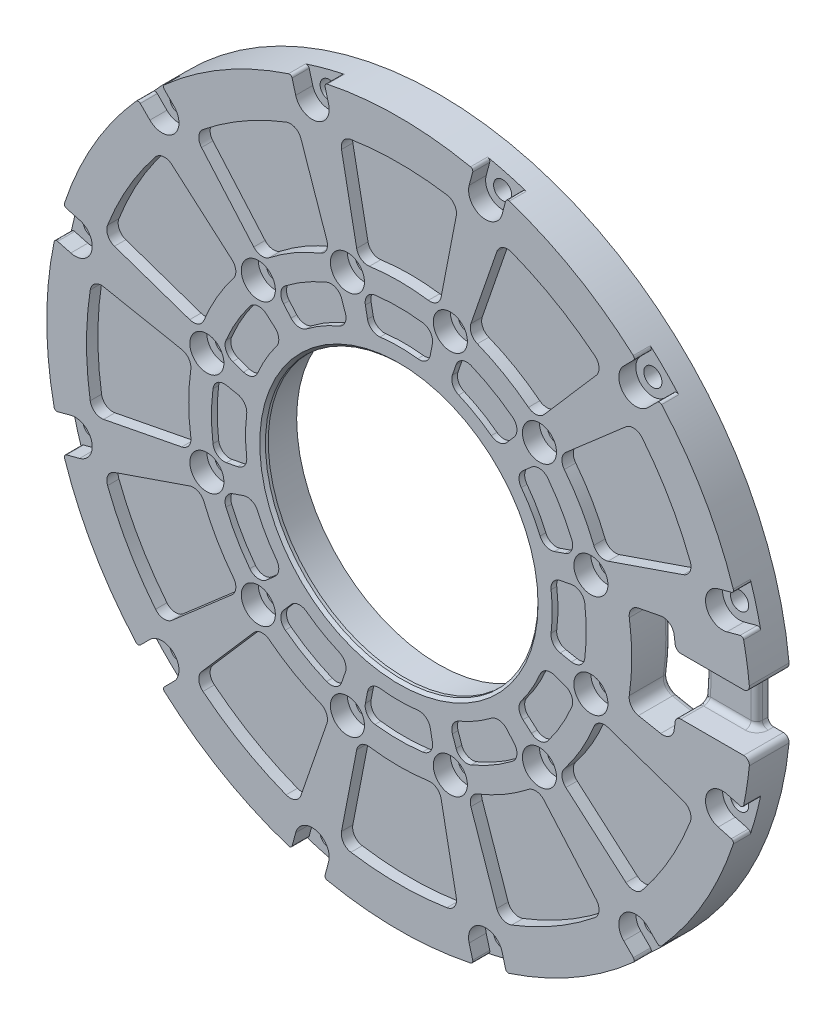
from build123d import *

# Parameters (mm, degrees)
SKETCH1_R           = 39.1
SKETCH1_R_2         = 2.525
SKETCH1_R_3         = 16
BOSS_EXTRUDE1_DEPTH = 7
SKETCH2_R           = 25
CUT_EXTRUDE1_DEPTH  = 6
SKETCH3_R           = 2.55
BOSS_EXTRUDE2_DEPTH = 2
CHAMFER3_SIZE       = 0.5
SKETCH4_R           = 39.1
CUT_EXTRUDE2_DEPTH  = 3
SKETCH5_R           = 24
CUT_EXTRUDE3_DEPTH  = 56.737061279
CHAMFER5_SIZE       = 0.5
SKETCH7_R           = 1.575
CUT_EXTRUDE5_DEPTH  = 56.737061279
BOSS_EXTRUDE3_START = -7
SKETCH8_R           = 62
SKETCH8_R_2         = 39.1
BOSS_EXTRUDE3_DEPTH = 7
SKETCH9_R           = 40
SKETCH9_R_2         = 39.1
CUT_EXTRUDE6_DEPTH  = 3
SKETCH11_R          = 1.6
CUT_EXTRUDE7_DEPTH  = 88.960218281
CUT_EXTRUDE9_DEPTH  = 1
CUT_EXTRUDE10_DEPTH = 2
CUT_EXTRUDE11_DEPTH = 88.960218281
SKETCH15_W          = 13
SKETCH15_H          = 5
CUT_EXTRUDE14_DEPTH = 5
SKETCH16_W          = 4
SKETCH16_H          = 10
CUT_EXTRUDE15_DEPTH = 88.960218281
FILLET3_R           = 1
CUT_EXTRUDE16_DEPTH = 3
SKETCH18_R          = 3
CUT_EXTRUDE17_DEPTH = 3
FILLET5_R           = 0.5
FILLET6_R           = 1


with BuildPart() as part:
    # Sketch1 → Boss-Extrude1 (new body)
    with BuildSketch(Plane.XY.offset(15)):
        Circle(SKETCH1_R)
        with Locations((32.5, 0)):
            Circle(SKETCH1_R_2, mode=Mode.SUBTRACT)
        with Locations((28.145825623, -16.25)):
            Circle(SKETCH1_R_2, mode=Mode.SUBTRACT)
        with Locations((16.25, -28.145825623)):
            Circle(SKETCH1_R_2, mode=Mode.SUBTRACT)
        with Locations((0, -32.5)):
            Circle(SKETCH1_R_2, mode=Mode.SUBTRACT)
        with Locations((-16.25, -28.145825623)):
            Circle(SKETCH1_R_2, mode=Mode.SUBTRACT)
        with Locations((-28.145825623, -16.25)):
            Circle(SKETCH1_R_2, mode=Mode.SUBTRACT)
        with Locations((-32.5, 0)):
            Circle(SKETCH1_R_2, mode=Mode.SUBTRACT)
        with Locations((-28.145825623, 16.25)):
            Circle(SKETCH1_R_2, mode=Mode.SUBTRACT)
        with Locations((-16.25, 28.145825623)):
            Circle(SKETCH1_R_2, mode=Mode.SUBTRACT)
        with Locations((0, 32.5)):
            Circle(SKETCH1_R_2, mode=Mode.SUBTRACT)
        with Locations((16.25, 28.145825623)):
            Circle(SKETCH1_R_2, mode=Mode.SUBTRACT)
        Circle(SKETCH1_R_3, mode=Mode.SUBTRACT)
        with Locations((28.145825623, 16.25)):
            Circle(SKETCH1_R_2, mode=Mode.SUBTRACT)
    extrude(amount=BOSS_EXTRUDE1_DEPTH)

    # Sketch2 → Cut-Extrude1 (cut)
    with BuildSketch(Plane(origin=(0, 0, 15), x_dir=(-1, 0, 0), z_dir=(0, 0, -1))):
        Circle(SKETCH2_R)
    extrude(amount=-CUT_EXTRUDE1_DEPTH, mode=Mode.SUBTRACT)

    # Sketch3 → Boss-Extrude2 (add)
    with BuildSketch(Plane.XY.offset(22)):
        with Locations((-16.25, 28.145825623)):
            Circle(SKETCH3_R)
        with Locations((0, 32.5)):
            Circle(SKETCH3_R)
        with Locations((16.25, 28.145825623)):
            Circle(SKETCH3_R)
        with Locations((28.145825623, 16.25)):
            Circle(SKETCH3_R)
        with Locations((32.5, 0)):
            Circle(SKETCH3_R)
        with Locations((28.145825623, -16.25)):
            Circle(SKETCH3_R)
        with Locations((16.25, -28.145825623)):
            Circle(SKETCH3_R)
        with Locations((0, -32.5)):
            Circle(SKETCH3_R)
        with Locations((-16.25, -28.145825623)):
            Circle(SKETCH3_R)
        with Locations((-28.145825623, -16.25)):
            Circle(SKETCH3_R)
        with Locations((-32.5, 0)):
            Circle(SKETCH3_R)
        with Locations((-28.145825623, 16.25)):
            Circle(SKETCH3_R)
    extrude(amount=-BOSS_EXTRUDE2_DEPTH)

    # Chamfer3
    chamfer3_edges = [part.edges().sort_by_distance(p)[0] for p in [
        (13.725, -28.145825623, 15),
        (-2.525, -32.5, 15),
        (-18.775, -28.145825623, 15),
        (-30.670825623, -16.25, 15),
        (-35.025, 0, 15),
        (-30.670825623, 16.25, 15),
        (-18.775, 28.145825623, 15),
        (-2.525, 32.5, 15),
        (13.725, 28.145825623, 15),
        (25.620825623, 16.25, 15),
        (29.975, 0, 15),
        (25.620825623, -16.25, 15),
    ]]
    chamfer(chamfer3_edges, length=CHAMFER3_SIZE)

    # Sketch4 → Cut-Extrude2 (cut)
    with BuildSketch(Plane(origin=(0, 0, 15), x_dir=(-1, 0, 0), z_dir=(0, 0, -1))):
        Circle(SKETCH4_R)
        with BuildLine():
            ThreePointArc((6.048999917, 32.39), (0, 38.55), (-6.048999917, 32.39))
            ThreePointArc((-6.048999917, 32.39), (-8.528087536, 31.827255976), (-10.956412404, 31.075062787))
            ThreePointArc((-10.956412404, 31.075062787), (-19.275, 33.385279316), (-21.433587596, 25.02606287))
            ThreePointArc((-21.433587596, 25.02606287), (-23.29916844, 23.29916844), (-25.02606287, 21.433587596))
            ThreePointArc((-25.02606287, 21.433587596), (-33.385279316, 19.275), (-31.075062787, 10.956412404))
            ThreePointArc((-31.075062787, 10.956412404), (-31.827255976, 8.528087536), (-32.39, 6.048999917))
            ThreePointArc((-32.39, 6.048999917), (-38.55, 0), (-32.39, -6.048999917))
            ThreePointArc((-32.39, -6.048999917), (-31.827255976, -8.528087536), (-31.075062787, -10.956412404))
            ThreePointArc((-31.075062787, -10.956412404), (-33.385279316, -19.275), (-25.02606287, -21.433587596))
            ThreePointArc((-25.02606287, -21.433587596), (-23.29916844, -23.29916844), (-21.433587596, -25.02606287))
            ThreePointArc((-21.433587596, -25.02606287), (-19.275, -33.385279316), (-10.956412404, -31.075062787))
            ThreePointArc((-10.956412404, -31.075062787), (-8.528087536, -31.827255976), (-6.048999917, -32.39))
            ThreePointArc((-6.048999917, -32.39), (0, -38.55), (6.048999917, -32.39))
            ThreePointArc((6.048999917, -32.39), (8.528087536, -31.827255976), (10.956412404, -31.075062787))
            ThreePointArc((10.956412404, -31.075062787), (19.275, -33.385279316), (21.433587596, -25.02606287))
            ThreePointArc((21.433587596, -25.02606287), (23.29916844, -23.29916844), (25.02606287, -21.433587596))
            ThreePointArc((25.02606287, -21.433587596), (33.385279316, -19.275), (31.075062787, -10.956412404))
            ThreePointArc((31.075062787, -10.956412404), (31.827255976, -8.528087536), (32.39, -6.048999917))
            ThreePointArc((32.39, -6.048999917), (38.55, 0), (32.39, 6.048999917))
            ThreePointArc((32.39, 6.048999917), (31.827255976, 8.528087536), (31.075062787, 10.956412404))
            ThreePointArc((31.075062787, 10.956412404), (33.385279316, 19.275), (25.02606287, 21.433587596))
            ThreePointArc((25.02606287, 21.433587596), (23.29916844, 23.29916844), (21.433587596, 25.02606287))
            ThreePointArc((21.433587596, 25.02606287), (19.275, 33.385279316), (10.956412404, 31.075062787))
            ThreePointArc((10.956412404, 31.075062787), (8.528087536, 31.827255976), (6.048999917, 32.39))
        make_face(mode=Mode.SUBTRACT)
    extrude(amount=-CUT_EXTRUDE2_DEPTH, mode=Mode.SUBTRACT)

    # Sketch5 → Cut-Extrude3 (cut, through all)
    with BuildSketch(Plane.XY.offset(22)):
        Circle(SKETCH5_R)
    extrude(amount=-CUT_EXTRUDE3_DEPTH, mode=Mode.SUBTRACT)

    # Chamfer5
    chamfer5_edges = [part.edges().sort_by_distance(p)[0] for p in [
        (-24, 0, 22),
    ]]
    chamfer(chamfer5_edges, length=CHAMFER5_SIZE)

    # Sketch7 → Cut-Extrude5 (cut, through all)
    with BuildSketch(Plane.XY.offset(22)):
        with Locations((-33.80740392, -9.058666579)):
            Circle(SKETCH7_R)
        with Locations((-33.80740392, 9.058666579)):
            Circle(SKETCH7_R)
        with Locations((-24.748737342, 24.748737342)):
            Circle(SKETCH7_R)
        with Locations((-9.058666579, 33.80740392)):
            Circle(SKETCH7_R)
        with Locations((9.058666579, 33.80740392)):
            Circle(SKETCH7_R)
        with Locations((24.748737342, 24.748737342)):
            Circle(SKETCH7_R)
        with Locations((33.80740392, 9.058666579)):
            Circle(SKETCH7_R)
        with Locations((33.80740392, -9.058666579)):
            Circle(SKETCH7_R)
        with Locations((24.748737342, -24.748737342)):
            Circle(SKETCH7_R)
        with Locations((9.058666579, -33.80740392)):
            Circle(SKETCH7_R)
        with Locations((-9.058666579, -33.80740392)):
            Circle(SKETCH7_R)
        with Locations((-24.748737342, -24.748737342)):
            Circle(SKETCH7_R)
    extrude(amount=-CUT_EXTRUDE5_DEPTH, mode=Mode.SUBTRACT)

    # Sketch8 → Boss-Extrude3 (add)
    with BuildSketch(Plane.XY.offset(22).offset(BOSS_EXTRUDE3_START)):
        Circle(SKETCH8_R)
        Circle(SKETCH8_R_2, mode=Mode.SUBTRACT)
    extrude(amount=BOSS_EXTRUDE3_DEPTH)

    # Sketch9 → Cut-Extrude6 (cut)
    with BuildSketch(Plane(origin=(0, 0, 15), x_dir=(-1, 0, 0), z_dir=(0, 0, -1))):
        Circle(SKETCH9_R)
        Circle(SKETCH9_R_2, mode=Mode.SUBTRACT)
    extrude(amount=-CUT_EXTRUDE6_DEPTH, mode=Mode.SUBTRACT)

    # Sketch11 → Cut-Extrude7 (cut, through all)
    with BuildSketch(Plane.XY.offset(22)):
        with Locations((-56.989623751, -15.270323661)):
            Circle(SKETCH11_R)
        with Locations((-56.989623751, 15.270323661)):
            Circle(SKETCH11_R)
        with Locations((-41.71930009, 41.71930009)):
            Circle(SKETCH11_R)
        with Locations((-15.270323661, 56.989623751)):
            Circle(SKETCH11_R)
        with Locations((15.270323661, 56.989623751)):
            Circle(SKETCH11_R)
        with Locations((41.71930009, 41.71930009)):
            Circle(SKETCH11_R)
        with Locations((56.989623751, 15.270323661)):
            Circle(SKETCH11_R)
        with Locations((56.989623751, -15.270323661)):
            Circle(SKETCH11_R)
        with Locations((41.71930009, -41.71930009)):
            Circle(SKETCH11_R)
        with Locations((15.270323661, -56.989623751)):
            Circle(SKETCH11_R)
        with Locations((-15.270323661, -56.989623751)):
            Circle(SKETCH11_R)
        with Locations((-41.71930009, -41.71930009)):
            Circle(SKETCH11_R)
    extrude(amount=-CUT_EXTRUDE7_DEPTH, mode=Mode.SUBTRACT)

    # Sketch12 → Cut-Extrude9 (cut)
    with BuildSketch(Plane.XY.offset(22)):
        with BuildLine():
            ThreePointArc((30.367045862, 5.902755762), (31.919981189, 5.560616967), (32.732448618, 4.193662776))
            ThreePointArc((32.732448618, 4.193662776), (33, 0), (32.732448618, -4.193662776))
            ThreePointArc((32.732448618, -4.193662776), (31.919981189, -5.560616967), (30.367045862, -5.902755762))
            Line((30.367045862, -5.902755762), (28.399409204, -5.52028594))
            ThreePointArc((28.399409204, -5.52028594), (27.162527298, -4.731960544), (26.796128768, -3.311719051))
            ThreePointArc((26.796128768, -3.311719051), (27, 0), (26.796128768, 3.311719051))
            ThreePointArc((26.796128768, 3.311719051), (27.162527298, 4.731960544), (28.399409204, 5.52028594))
            Line((28.399409204, 5.52028594), (30.367045862, 5.902755762))
        make_face()
        with BuildLine():
            ThreePointArc((29.250011036, -10.071586489), (30.423823082, -11.14435504), (30.443963419, -12.73440581))
            ThreePointArc((30.443963419, -12.73440581), (28.578838325, -16.5), (26.250300643, -19.998042808))
            ThreePointArc((26.250300643, -19.998042808), (24.863206115, -20.775626149), (23.347255274, -20.295459374))
            Line((23.347255274, -20.295459374), (21.834466853, -18.980412463))
            ThreePointArc((21.834466853, -18.980412463), (21.157458399, -17.67926169), (21.55026871, -16.266097212))
            ThreePointArc((21.55026871, -16.266097212), (23.382685902, -13.5), (24.861987761, -10.530031555))
            ThreePointArc((24.861987761, -10.530031555), (25.889418943, -9.483265609), (27.354752793, -9.418996741))
            Line((27.354752793, -9.418996741), (29.250011036, -10.071586489))
        make_face()
        with BuildLine():
            ThreePointArc((20.295459374, -23.347255274), (20.775626149, -24.863206115), (19.998042808, -26.250300643))
            ThreePointArc((19.998042808, -26.250300643), (16.5, -28.578838325), (12.73440581, -30.443963419))
            ThreePointArc((12.73440581, -30.443963419), (11.14435504, -30.423823082), (10.071586489, -29.250011036))
            Line((10.071586489, -29.250011036), (9.418996741, -27.354752793))
            ThreePointArc((9.418996741, -27.354752793), (9.483265609, -25.889418943), (10.530031555, -24.861987761))
            ThreePointArc((10.530031555, -24.861987761), (13.5, -23.382685902), (16.266097212, -21.55026871))
            ThreePointArc((16.266097212, -21.55026871), (17.67926169, -21.157458399), (18.980412463, -21.834466853))
            Line((18.980412463, -21.834466853), (20.295459374, -23.347255274))
        make_face()
        with BuildLine():
            ThreePointArc((5.902755762, -30.367045862), (5.560616967, -31.919981189), (4.193662776, -32.732448618))
            ThreePointArc((4.193662776, -32.732448618), (0, -33), (-4.193662776, -32.732448618))
            ThreePointArc((-4.193662776, -32.732448618), (-5.560616967, -31.919981189), (-5.902755762, -30.367045862))
            Line((-5.902755762, -30.367045862), (-5.52028594, -28.399409204))
            ThreePointArc((-5.52028594, -28.399409204), (-4.731960544, -27.162527298), (-3.311719051, -26.796128768))
            ThreePointArc((-3.311719051, -26.796128768), (0, -27), (3.311719051, -26.796128768))
            ThreePointArc((3.311719051, -26.796128768), (4.731960544, -27.162527298), (5.52028594, -28.399409204))
            Line((5.52028594, -28.399409204), (5.902755762, -30.367045862))
        make_face()
        with BuildLine():
            Line((-30.367045862, 5.902755762), (-28.399409204, 5.52028594))
            ThreePointArc((-28.399409204, 5.52028594), (-27.162527298, 4.731960544), (-26.796128768, 3.311719051))
            ThreePointArc((-26.796128768, 3.311719051), (-27, 0), (-26.796128768, -3.311719051))
            ThreePointArc((-26.796128768, -3.311719051), (-27.162527298, -4.731960544), (-28.399409204, -5.52028594))
            Line((-28.399409204, -5.52028594), (-30.367045862, -5.902755762))
            ThreePointArc((-30.367045862, -5.902755762), (-31.919981189, -5.560616967), (-32.732448618, -4.193662776))
            ThreePointArc((-32.732448618, -4.193662776), (-33, 0), (-32.732448618, 4.193662776))
            ThreePointArc((-32.732448618, 4.193662776), (-31.919981189, 5.560616967), (-30.367045862, 5.902755762))
        make_face()
        with BuildLine():
            ThreePointArc((-10.071586489, -29.250011036), (-11.14435504, -30.423823082), (-12.73440581, -30.443963419))
            ThreePointArc((-12.73440581, -30.443963419), (-16.5, -28.578838325), (-19.998042808, -26.250300643))
            ThreePointArc((-19.998042808, -26.250300643), (-20.775626149, -24.863206115), (-20.295459374, -23.347255274))
            Line((-20.295459374, -23.347255274), (-18.980412463, -21.834466853))
            ThreePointArc((-18.980412463, -21.834466853), (-17.67926169, -21.157458399), (-16.266097212, -21.55026871))
            ThreePointArc((-16.266097212, -21.55026871), (-13.5, -23.382685902), (-10.530031555, -24.861987761))
            ThreePointArc((-10.530031555, -24.861987761), (-9.483265609, -25.889418943), (-9.418996741, -27.354752793))
            Line((-9.418996741, -27.354752793), (-10.071586489, -29.250011036))
        make_face()
        with BuildLine():
            ThreePointArc((-29.250011036, 10.071586489), (-30.423823082, 11.14435504), (-30.443963419, 12.73440581))
            ThreePointArc((-30.443963419, 12.73440581), (-28.578838325, 16.5), (-26.250300643, 19.998042808))
            ThreePointArc((-26.250300643, 19.998042808), (-24.863206115, 20.775626149), (-23.347255274, 20.295459374))
            Line((-23.347255274, 20.295459374), (-21.834466853, 18.980412463))
            ThreePointArc((-21.834466853, 18.980412463), (-21.157458399, 17.67926169), (-21.55026871, 16.266097212))
            ThreePointArc((-21.55026871, 16.266097212), (-23.382685902, 13.5), (-24.861987761, 10.530031555))
            ThreePointArc((-24.861987761, 10.530031555), (-25.889418943, 9.483265609), (-27.354752793, 9.418996741))
            Line((-27.354752793, 9.418996741), (-29.250011036, 10.071586489))
        make_face()
        with BuildLine():
            ThreePointArc((-20.295459374, 23.347255274), (-20.775626149, 24.863206115), (-19.998042808, 26.250300643))
            ThreePointArc((-19.998042808, 26.250300643), (-16.5, 28.578838325), (-12.73440581, 30.443963419))
            ThreePointArc((-12.73440581, 30.443963419), (-11.14435504, 30.423823082), (-10.071586489, 29.250011036))
            Line((-10.071586489, 29.250011036), (-9.418996741, 27.354752793))
            ThreePointArc((-9.418996741, 27.354752793), (-9.483265609, 25.889418943), (-10.530031555, 24.861987761))
            ThreePointArc((-10.530031555, 24.861987761), (-13.5, 23.382685902), (-16.266097212, 21.55026871))
            ThreePointArc((-16.266097212, 21.55026871), (-17.67926169, 21.157458399), (-18.980412463, 21.834466853))
            Line((-18.980412463, 21.834466853), (-20.295459374, 23.347255274))
        make_face()
        with BuildLine():
            ThreePointArc((-5.902755762, 30.367045862), (-5.560616967, 31.919981189), (-4.193662776, 32.732448618))
            ThreePointArc((-4.193662776, 32.732448618), (0, 33), (4.193662776, 32.732448618))
            ThreePointArc((4.193662776, 32.732448618), (5.560616967, 31.919981189), (5.902755762, 30.367045862))
            Line((5.902755762, 30.367045862), (5.52028594, 28.399409204))
            ThreePointArc((5.52028594, 28.399409204), (4.731960544, 27.162527298), (3.311719051, 26.796128768))
            ThreePointArc((3.311719051, 26.796128768), (0, 27), (-3.311719051, 26.796128768))
            ThreePointArc((-3.311719051, 26.796128768), (-4.731960544, 27.162527298), (-5.52028594, 28.399409204))
            Line((-5.52028594, 28.399409204), (-5.902755762, 30.367045862))
        make_face()
        with BuildLine():
            ThreePointArc((10.071586489, 29.250011036), (11.14435504, 30.423823082), (12.73440581, 30.443963419))
            ThreePointArc((12.73440581, 30.443963419), (16.5, 28.578838325), (19.998042808, 26.250300643))
            ThreePointArc((19.998042808, 26.250300643), (20.775626149, 24.863206115), (20.295459374, 23.347255274))
            Line((20.295459374, 23.347255274), (18.980412463, 21.834466853))
            ThreePointArc((18.980412463, 21.834466853), (17.67926169, 21.157458399), (16.266097212, 21.55026871))
            ThreePointArc((16.266097212, 21.55026871), (13.5, 23.382685902), (10.530031555, 24.861987761))
            ThreePointArc((10.530031555, 24.861987761), (9.483265609, 25.889418943), (9.418996741, 27.354752793))
            Line((9.418996741, 27.354752793), (10.071586489, 29.250011036))
        make_face()
        with BuildLine():
            ThreePointArc((23.347255274, 20.295459374), (24.863206115, 20.775626149), (26.250300643, 19.998042808))
            ThreePointArc((26.250300643, 19.998042808), (28.578838325, 16.5), (30.443963419, 12.73440581))
            ThreePointArc((30.443963419, 12.73440581), (30.423823082, 11.14435504), (29.250011036, 10.071586489))
            Line((29.250011036, 10.071586489), (27.354752793, 9.418996741))
            ThreePointArc((27.354752793, 9.418996741), (25.889418943, 9.483265609), (24.861987761, 10.530031555))
            ThreePointArc((24.861987761, 10.530031555), (23.382685902, 13.5), (21.55026871, 16.266097212))
            ThreePointArc((21.55026871, 16.266097212), (21.157458399, 17.67926169), (21.834466853, 18.980412463))
            Line((21.834466853, 18.980412463), (23.347255274, 20.295459374))
        make_face()
        with BuildLine():
            ThreePointArc((-23.347255274, -20.295459374), (-24.863206115, -20.775626149), (-26.250300643, -19.998042808))
            ThreePointArc((-26.250300643, -19.998042808), (-28.578838325, -16.5), (-30.443963419, -12.73440581))
            ThreePointArc((-30.443963419, -12.73440581), (-30.423823082, -11.14435504), (-29.250011036, -10.071586489))
            Line((-29.250011036, -10.071586489), (-27.354752793, -9.418996741))
            ThreePointArc((-27.354752793, -9.418996741), (-25.889418943, -9.483265609), (-24.861987761, -10.530031555))
            ThreePointArc((-24.861987761, -10.530031555), (-23.382685902, -13.5), (-21.55026871, -16.266097212))
            ThreePointArc((-21.55026871, -16.266097212), (-21.157458399, -17.67926169), (-21.834466853, -18.980412463))
            Line((-21.834466853, -18.980412463), (-23.347255274, -20.295459374))
        make_face()
    extrude(amount=-CUT_EXTRUDE9_DEPTH, mode=Mode.SUBTRACT)

    # Sketch12<3> → Cut-Extrude10 (cut)
    with BuildSketch(Plane.XY.offset(22)):
        with BuildLine():
            ThreePointArc((29.132341965, -22.810231293), (32.04293994, -18.5), (34.320410749, -13.824232567))
            ThreePointArc((34.320410749, -13.824232567), (35.345221414, -12.752003728), (36.826704395, -12.68045123))
            Line((36.826704395, -12.68045123), (50.076791849, -17.242822219))
            ThreePointArc((50.076791849, -17.242822219), (51.239468775, -18.291196003), (51.290774618, -19.855891799))
            ThreePointArc((51.290774618, -19.855891799), (47.631397208, -27.5), (42.841094021, -34.491167899))
            ThreePointArc((42.841094021, -34.491167899), (41.460374791, -35.229083634), (39.971117999, -34.746362772))
            Line((39.971117999, -34.746362772), (29.394945094, -25.552635929))
            ThreePointArc((29.394945094, -25.552635929), (28.716169884, -24.233857783), (29.132341965, -22.810231293))
        make_face()
        with BuildLine():
            ThreePointArc((13.824232567, -34.320410749), (18.5, -32.04293994), (22.810231293, -29.132341965))
            ThreePointArc((22.810231293, -29.132341965), (24.233857783, -28.716169884), (25.552635929, -29.394945094))
            Line((25.552635929, -29.394945094), (34.746362772, -39.971117999))
            ThreePointArc((34.746362772, -39.971117999), (35.229083634, -41.460374791), (34.491167899, -42.841094021))
            ThreePointArc((34.491167899, -42.841094021), (27.5, -47.631397208), (19.855891799, -51.290774618))
            ThreePointArc((19.855891799, -51.290774618), (18.291196003, -51.239468775), (17.242822219, -50.076791849))
            Line((17.242822219, -50.076791849), (12.68045123, -36.826704395))
            ThreePointArc((12.68045123, -36.826704395), (12.752003728, -35.345221414), (13.824232567, -34.320410749))
        make_face()
        with BuildLine():
            ThreePointArc((-5.188068784, -36.63446386), (0, -37), (5.188068784, -36.63446386))
            ThreePointArc((5.188068784, -36.63446386), (6.62905153, -36.985861511), (7.431759301, -38.233087159))
            Line((7.431759301, -38.233087159), (10.10567385, -51.989184991))
            ThreePointArc((10.10567385, -51.989184991), (9.779093984, -53.520279637), (8.449680596, -54.347059698))
            ThreePointArc((8.449680596, -54.347059698), (0, -55), (-8.449680596, -54.347059698))
            ThreePointArc((-8.449680596, -54.347059698), (-9.779093984, -53.520279637), (-10.10567385, -51.989184991))
            Line((-10.10567385, -51.989184991), (-7.431759301, -38.233087159))
            ThreePointArc((-7.431759301, -38.233087159), (-6.62905153, -36.985861511), (-5.188068784, -36.63446386))
        make_face()
        with BuildLine():
            ThreePointArc((-22.810231293, -29.132341965), (-18.5, -32.04293994), (-13.824232567, -34.320410749))
            ThreePointArc((-13.824232567, -34.320410749), (-12.752003728, -35.345221414), (-12.68045123, -36.826704395))
            Line((-12.68045123, -36.826704395), (-17.242822219, -50.076791849))
            ThreePointArc((-17.242822219, -50.076791849), (-18.291196003, -51.239468775), (-19.855891799, -51.290774618))
            ThreePointArc((-19.855891799, -51.290774618), (-27.5, -47.631397208), (-34.491167899, -42.841094021))
            ThreePointArc((-34.491167899, -42.841094021), (-35.229083634, -41.460374791), (-34.746362772, -39.971117999))
            Line((-34.746362772, -39.971117999), (-25.552635929, -29.394945094))
            ThreePointArc((-25.552635929, -29.394945094), (-24.233857783, -28.716169884), (-22.810231293, -29.132341965))
        make_face()
        with BuildLine():
            Line((-51.989184991, 10.10567385), (-38.233087159, 7.431759301))
            ThreePointArc((-38.233087159, 7.431759301), (-36.985861511, 6.62905153), (-36.63446386, 5.188068784))
            ThreePointArc((-36.63446386, 5.188068784), (-37, 0), (-36.63446386, -5.188068784))
            ThreePointArc((-36.63446386, -5.188068784), (-36.985861511, -6.62905153), (-38.233087159, -7.431759301))
            Line((-38.233087159, -7.431759301), (-51.989184991, -10.10567385))
            ThreePointArc((-51.989184991, -10.10567385), (-53.520279637, -9.779093984), (-54.347059698, -8.449680596))
            ThreePointArc((-54.347059698, -8.449680596), (-55, 0), (-54.347059698, 8.449680596))
            ThreePointArc((-54.347059698, 8.449680596), (-53.520279637, 9.779093984), (-51.989184991, 10.10567385))
        make_face()
        with BuildLine():
            ThreePointArc((-29.132341965, 22.810231293), (-32.04293994, 18.5), (-34.320410749, 13.824232567))
            ThreePointArc((-34.320410749, 13.824232567), (-35.345221414, 12.752003728), (-36.826704395, 12.68045123))
            Line((-36.826704395, 12.68045123), (-50.076791849, 17.242822219))
            ThreePointArc((-50.076791849, 17.242822219), (-51.239468775, 18.291196003), (-51.290774618, 19.855891799))
            ThreePointArc((-51.290774618, 19.855891799), (-47.631397208, 27.5), (-42.841094021, 34.491167899))
            ThreePointArc((-42.841094021, 34.491167899), (-41.460374791, 35.229083634), (-39.971117999, 34.746362772))
            Line((-39.971117999, 34.746362772), (-29.394945094, 25.552635929))
            ThreePointArc((-29.394945094, 25.552635929), (-28.716169884, 24.233857783), (-29.132341965, 22.810231293))
        make_face()
        with BuildLine():
            ThreePointArc((-13.824232567, 34.320410749), (-18.5, 32.04293994), (-22.810231293, 29.132341965))
            ThreePointArc((-22.810231293, 29.132341965), (-24.233857783, 28.716169884), (-25.552635929, 29.394945094))
            Line((-25.552635929, 29.394945094), (-34.746362772, 39.971117999))
            ThreePointArc((-34.746362772, 39.971117999), (-35.229083634, 41.460374791), (-34.491167899, 42.841094021))
            ThreePointArc((-34.491167899, 42.841094021), (-27.5, 47.631397208), (-19.855891799, 51.290774618))
            ThreePointArc((-19.855891799, 51.290774618), (-18.291196003, 51.239468775), (-17.242822219, 50.076791849))
            Line((-17.242822219, 50.076791849), (-12.68045123, 36.826704395))
            ThreePointArc((-12.68045123, 36.826704395), (-12.752003728, 35.345221414), (-13.824232567, 34.320410749))
        make_face()
        with BuildLine():
            ThreePointArc((5.188068784, 36.63446386), (0, 37), (-5.188068784, 36.63446386))
            ThreePointArc((-5.188068784, 36.63446386), (-6.62905153, 36.985861511), (-7.431759301, 38.233087159))
            Line((-7.431759301, 38.233087159), (-10.10567385, 51.989184991))
            ThreePointArc((-10.10567385, 51.989184991), (-9.779093984, 53.520279637), (-8.449680596, 54.347059698))
            ThreePointArc((-8.449680596, 54.347059698), (0, 55), (8.449680596, 54.347059698))
            ThreePointArc((8.449680596, 54.347059698), (9.779093984, 53.520279637), (10.10567385, 51.989184991))
            Line((10.10567385, 51.989184991), (7.431759301, 38.233087159))
            ThreePointArc((7.431759301, 38.233087159), (6.62905153, 36.985861511), (5.188068784, 36.63446386))
        make_face()
        with BuildLine():
            ThreePointArc((22.810231293, 29.132341965), (18.5, 32.04293994), (13.824232567, 34.320410749))
            ThreePointArc((13.824232567, 34.320410749), (12.752003728, 35.345221414), (12.68045123, 36.826704395))
            Line((12.68045123, 36.826704395), (17.242822219, 50.076791849))
            ThreePointArc((17.242822219, 50.076791849), (18.291196003, 51.239468775), (19.855891799, 51.290774618))
            ThreePointArc((19.855891799, 51.290774618), (27.5, 47.631397208), (34.491167899, 42.841094021))
            ThreePointArc((34.491167899, 42.841094021), (35.229083634, 41.460374791), (34.746362772, 39.971117999))
            Line((34.746362772, 39.971117999), (25.552635929, 29.394945094))
            ThreePointArc((25.552635929, 29.394945094), (24.233857783, 28.716169884), (22.810231293, 29.132341965))
        make_face()
        with BuildLine():
            ThreePointArc((34.320410749, 13.824232567), (32.04293994, 18.5), (29.132341965, 22.810231293))
            ThreePointArc((29.132341965, 22.810231293), (28.716169884, 24.233857783), (29.394945094, 25.552635929))
            Line((29.394945094, 25.552635929), (39.971117999, 34.746362772))
            ThreePointArc((39.971117999, 34.746362772), (41.460374791, 35.229083634), (42.841094021, 34.491167899))
            ThreePointArc((42.841094021, 34.491167899), (47.631397208, 27.5), (51.290774618, 19.855891799))
            ThreePointArc((51.290774618, 19.855891799), (51.239468775, 18.291196003), (50.076791849, 17.242822219))
            Line((50.076791849, 17.242822219), (36.826704395, 12.68045123))
            ThreePointArc((36.826704395, 12.68045123), (35.345221414, 12.752003728), (34.320410749, 13.824232567))
        make_face()
        with BuildLine():
            ThreePointArc((-34.320410749, -13.824232567), (-32.04293994, -18.5), (-29.132341965, -22.810231293))
            ThreePointArc((-29.132341965, -22.810231293), (-28.716169884, -24.233857783), (-29.394945094, -25.552635929))
            Line((-29.394945094, -25.552635929), (-39.971117999, -34.746362772))
            ThreePointArc((-39.971117999, -34.746362772), (-41.460374791, -35.229083634), (-42.841094021, -34.491167899))
            ThreePointArc((-42.841094021, -34.491167899), (-47.631397208, -27.5), (-51.290774618, -19.855891799))
            ThreePointArc((-51.290774618, -19.855891799), (-51.239468775, -18.291196003), (-50.076791849, -17.242822219))
            Line((-50.076791849, -17.242822219), (-36.826704395, -12.68045123))
            ThreePointArc((-36.826704395, -12.68045123), (-35.345221414, -12.752003728), (-34.320410749, -13.824232567))
        make_face()
    extrude(amount=-CUT_EXTRUDE10_DEPTH, mode=Mode.SUBTRACT)

    # Sketch13 → Cut-Extrude11 (cut, through all)
    with BuildSketch(Plane.XY.offset(22)):
        with BuildLine():
            Line((46.094687326, 8.959899572), (42.16428709, 8.195907159))
            ThreePointArc((42.16428709, 8.195907159), (40.914294622, 7.389306289), (40.567025775, 5.942761965))
            ThreePointArc((40.567025775, 5.942761965), (41, 0), (40.567025775, -5.942761965))
            ThreePointArc((40.567025775, -5.942761965), (40.914294622, -7.389306289), (42.16428709, -8.195907159))
            Line((42.16428709, -8.195907159), (46.094687326, -8.959899572))
            ThreePointArc((46.094687326, -8.959899572), (47.629724023, -8.630544005), (48.454020436, -7.294374788))
            ThreePointArc((48.454020436, -7.294374788), (49, 0), (48.454020436, 7.294374788))
            ThreePointArc((48.454020436, 7.294374788), (47.629724023, 8.630544005), (46.094687326, 8.959899572))
        make_face()
    extrude(amount=-CUT_EXTRUDE11_DEPTH, mode=Mode.SUBTRACT)

    # Sketch15 → Cut-Extrude14 (cut)
    with BuildSketch(Plane.XY.offset(22)):
        with Locations((55.5, 2.5)):
            Rectangle(SKETCH15_W, SKETCH15_H)
        with Locations((55.5, -2.5)):
            Rectangle(SKETCH15_W, SKETCH15_H)
        Polygon((49, 5), (48.20521855, 5), (48.20521855, -5), (49, -5), (49, 0), align=None)
    extrude(amount=-CUT_EXTRUDE14_DEPTH, mode=Mode.SUBTRACT)

    # Sketch16 → Cut-Extrude15 (cut, through all)
    with BuildSketch(Plane.XY.offset(22)):
        with Locations((60, 0)):
            Rectangle(SKETCH16_W, SKETCH16_H)
    extrude(amount=-CUT_EXTRUDE15_DEPTH, mode=Mode.SUBTRACT)

    # Fillet3
    fillet3_edges = [part.edges().sort_by_distance(p)[0] for p in [
        (49, 0, 17),
        (48.744230428, 5, 19.5),
        (48.744230428, -5, 19.5),
        (61.798058222, -5, 18.5),
        (61.798058222, 5, 18.5),
        (53.372115214, 5, 17),
        (53.372115214, -5, 17),
        (58, 0, 17),
        (58, 5, 16),
        (58, -5, 16),
    ]]
    fillet(fillet3_edges, radius=FILLET3_R)

    # Sketch17 → Cut-Extrude16 (cut)
    with BuildSketch(Plane.XY.offset(22)):
        with BuildLine():
            Line((-43.840620434, 39.597979746), (-46.669047558, 42.426406871))
            Line((-46.669047558, 42.426406871), (-42.426406871, 46.669047558))
            Line((-42.426406871, 46.669047558), (-39.597979746, 43.840620434))
            ThreePointArc((-39.597979746, 43.840620434), (-39.597979746, 39.597979746), (-43.840620434, 39.597979746))
        make_face()
        with BuildLine():
            Line((39.597979746, 43.840620434), (42.426406871, 46.669047558))
            Line((42.426406871, 46.669047558), (46.669047558, 42.426406871))
            Line((46.669047558, 42.426406871), (43.840620434, 39.597979746))
            ThreePointArc((43.840620434, 39.597979746), (39.597979746, 39.597979746), (39.597979746, 43.840620434))
        make_face()
        with BuildLine():
            Line((56.213166616, 18.16810114), (60.076869921, 19.20337732))
            Line((60.076869921, 19.20337732), (61.629784192, 13.407822363))
            Line((61.629784192, 13.407822363), (57.766080886, 12.372546182))
            ThreePointArc((57.766080886, 12.372546182), (54.091846272, 14.493866526), (56.213166616, 18.16810114))
        make_face()
        with BuildLine():
            Line((43.840620434, -39.597979746), (46.669047558, -42.426406871))
            Line((46.669047558, -42.426406871), (42.426406871, -46.669047558))
            Line((42.426406871, -46.669047558), (39.597979746, -43.840620434))
            ThreePointArc((39.597979746, -43.840620434), (39.597979746, -39.597979746), (43.840620434, -39.597979746))
        make_face()
        with BuildLine():
            Line((-39.597979746, -43.840620434), (-42.426406871, -46.669047558))
            Line((-42.426406871, -46.669047558), (-46.669047558, -42.426406871))
            Line((-46.669047558, -42.426406871), (-43.840620434, -39.597979746))
            ThreePointArc((-43.840620434, -39.597979746), (-39.597979746, -39.597979746), (-39.597979746, -43.840620434))
        make_face()
        with BuildLine():
            Line((-56.213166616, 18.16810114), (-60.076869921, 19.20337732))
            Line((-60.076869921, 19.20337732), (-61.629784192, 13.407822363))
            Line((-61.629784192, 13.407822363), (-57.766080886, 12.372546182))
            ThreePointArc((-57.766080886, 12.372546182), (-54.091846272, 14.493866526), (-56.213166616, 18.16810114))
        make_face()
        with BuildLine():
            Line((-13.407822363, 61.629784192), (-19.20337732, 60.076869921))
            Line((-19.20337732, 60.076869921), (-18.16810114, 56.213166616))
            ThreePointArc((-18.16810114, 56.213166616), (-14.493866526, 54.091846272), (-12.372546182, 57.766080886))
            Line((-12.372546182, 57.766080886), (-13.407822363, 61.629784192))
        make_face()
        with BuildLine():
            Line((19.20337732, 60.076869921), (13.407822363, 61.629784192))
            Line((13.407822363, 61.629784192), (12.372546182, 57.766080886))
            ThreePointArc((12.372546182, 57.766080886), (14.493866526, 54.091846272), (18.16810114, 56.213166616))
            Line((18.16810114, 56.213166616), (19.20337732, 60.076869921))
        make_face()
        with BuildLine():
            Line((60.076869921, -19.20337732), (61.629784192, -13.407822363))
            Line((61.629784192, -13.407822363), (57.766080886, -12.372546182))
            ThreePointArc((57.766080886, -12.372546182), (54.091846272, -14.493866526), (56.213166616, -18.16810114))
            Line((56.213166616, -18.16810114), (60.076869921, -19.20337732))
        make_face()
        with BuildLine():
            Line((18.16810114, -56.213166616), (19.20337732, -60.076869921))
            Line((19.20337732, -60.076869921), (13.407822363, -61.629784192))
            Line((13.407822363, -61.629784192), (12.372546182, -57.766080886))
            ThreePointArc((12.372546182, -57.766080886), (14.493866526, -54.091846272), (18.16810114, -56.213166616))
        make_face()
        with BuildLine():
            Line((-19.20337732, -60.076869921), (-13.407822363, -61.629784192))
            Line((-13.407822363, -61.629784192), (-12.372546182, -57.766080886))
            ThreePointArc((-12.372546182, -57.766080886), (-14.493866526, -54.091846272), (-18.16810114, -56.213166616))
            Line((-18.16810114, -56.213166616), (-19.20337732, -60.076869921))
        make_face()
        with BuildLine():
            Line((-61.629784192, -13.407822363), (-60.076869921, -19.20337732))
            Line((-60.076869921, -19.20337732), (-56.213166616, -18.16810114))
            ThreePointArc((-56.213166616, -18.16810114), (-54.091846272, -14.493866526), (-57.766080886, -12.372546182))
            Line((-57.766080886, -12.372546182), (-61.629784192, -13.407822363))
        make_face()
    extrude(amount=-CUT_EXTRUDE16_DEPTH, mode=Mode.SUBTRACT)

    # Sketch18 → Cut-Extrude17 (cut)
    with BuildSketch(Plane.XY.offset(22)):
        with Locations((-33.80740392, -9.058666579)):
            Circle(SKETCH18_R)
        with Locations((-33.80740392, 9.058666579)):
            Circle(SKETCH18_R)
        with Locations((-24.748737342, 24.748737342)):
            Circle(SKETCH18_R)
        with Locations((-9.058666579, 33.80740392)):
            Circle(SKETCH18_R)
        with Locations((9.058666579, 33.80740392)):
            Circle(SKETCH18_R)
        with Locations((24.748737342, 24.748737342)):
            Circle(SKETCH18_R)
        with Locations((33.80740392, 9.058666579)):
            Circle(SKETCH18_R)
        with Locations((33.80740392, -9.058666579)):
            Circle(SKETCH18_R)
        with Locations((24.748737342, -24.748737342)):
            Circle(SKETCH18_R)
        with Locations((9.058666579, -33.80740392)):
            Circle(SKETCH18_R)
        with Locations((-9.058666579, -33.80740392)):
            Circle(SKETCH18_R)
        with Locations((-24.748737342, -24.748737342)):
            Circle(SKETCH18_R)
    extrude(amount=-CUT_EXTRUDE17_DEPTH, mode=Mode.SUBTRACT)

    # Fillet5
    fillet5_edges = [part.edges().sort_by_distance(p)[0] for p in [
        (-41.667947748, 45.910588435, 20.5),
        (-45.910588435, 41.667947748, 20.5),
        (-59.040795491, -18.925762014, 20.5),
        (-60.593709762, -13.130207056, 20.5),
        (-13.130207056, -60.593709762, 20.5),
        (-18.925762014, -59.040795491, 20.5),
        (13.130207056, -60.593709762, 20.5),
        (18.925762014, -59.040795491, 20.5),
        (45.910588435, 41.667947748, 20.5),
        (41.667947748, 45.910588435, 20.5),
        (60.593709762, 13.130207056, 20.5),
        (59.040795491, 18.925762014, 20.5),
        (41.667947748, -45.910588435, 20.5),
        (45.910588435, -41.667947748, 20.5),
        (-45.910588435, -41.667947748, 20.5),
        (-41.667947748, -45.910588435, 20.5),
        (-59.040795491, 18.925762014, 20.5),
        (-60.593709762, 13.130207056, 20.5),
        (-18.925762014, 59.040795491, 20.5),
        (-13.130207056, 60.593709762, 20.5),
        (13.130207056, 60.593709762, 20.5),
        (18.925762014, 59.040795491, 20.5),
        (60.593709762, -13.130207056, 20.5),
        (59.040795491, -18.925762014, 20.5),
    ]]
    fillet(fillet5_edges, radius=FILLET5_R)

    # Fillet6
    fillet6_edges = [part.edges().sort_by_distance(p)[0] for p in [
        (40.914294622, -7.389306289, 15),
        (41, 0, 15),
        (40.914294622, 7.389306289, 15),
        (44.129487208, 8.577903366, 15),
        (47.629724023, 8.630544005, 15),
        (49, 0, 15),
        (47.629724023, -8.630544005, 15),
        (44.129487208, -8.577903366, 15),
    ]]
    fillet(fillet6_edges, radius=FILLET6_R - 0.0001)  # a hair under: the kernel refuses the full size


solid = part.part
